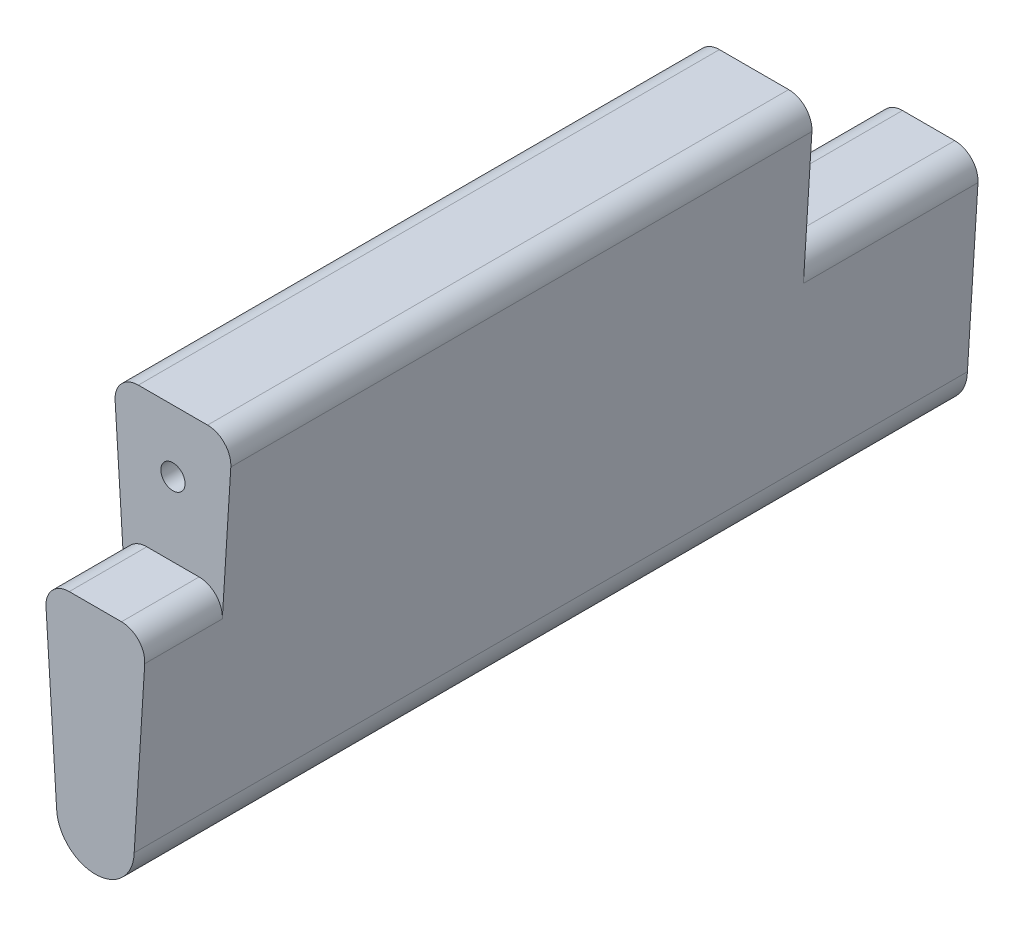
from build123d import *

# Parameters (mm, degrees)
BOSS_EXTRUDE1_DEPTH             = 76.2
BOSS_EXTRUDE1_DEPTH_BACK        = 76.2
CUT_EXTRUDE1_DEPTH              = 136.619651209
CUT_EXTRUDE1_DEPTH_BACK         = 136.619651209
FILLET1_R                       = 3.81
SHELL1_START                    = -44.45
SHELL1_DEPTH                    = 88.773
SHELL1_START_2                  = -73.025
SHELL1_2_DEPTH                  = 130.048
SKETCH14_R                      = 1.984375
CUT_EXTRUDE8_DEPTH              = 156.372005628
BOSS_EXTRUDE4_REACH             = 137.201
SKETCH15_R                      = 1.5875
BOSS_EXTRUDE4_DIRECTION_2_REACH = 137.201


# Read off the part's stored shape, not the designer's step: Shell1
with BuildPart() as part:
    # Sketch1 → Boss-Extrude1 (new, two sides: drawn at the far end of the back side and taken through both)
    with BuildSketch(Plane.XY.offset(-BOSS_EXTRUDE1_DEPTH_BACK)):
        with BuildLine():
            Line((-6.335258536, -105.245804705), (-12.685258536, -3.645804705))
            ThreePointArc((-12.685258536, -3.645804705), (0.014741464, 8.866413132), (12.714741464, -3.645804705))
            Line((12.714741464, -3.645804705), (6.364741464, -105.245804705))
            ThreePointArc((6.364741464, -105.245804705), (0.014741464, -111.465623147), (-6.335258536, -105.245804705))
        make_face()
    extrude(amount=BOSS_EXTRUDE1_DEPTH + BOSS_EXTRUDE1_DEPTH_BACK)

    # Sketch4 → Cut-Extrude1 (cut, two sides: drawn at the far end of the back side and taken through both)
    with BuildSketch(Plane(origin=(0, 0, 0), x_dir=(0, 0, -1), z_dir=(1, 0, 0)).offset(-CUT_EXTRUDE1_DEPTH_BACK)):
        Polygon((-47.498, -73.524605007), (-47.498, -51.299605007), (47.625, -51.299605007), (47.625, -73.524605007), (76.2, -73.524605007), (76.2, 8.866413132), (-76.2, 8.866413132), (-76.2, -28.682279346), (-76.2, -111.465623147), (-60.198, -111.465623147), (-60.198, -73.524605007), align=None)
    extrude(amount=CUT_EXTRUDE1_DEPTH + CUT_EXTRUDE1_DEPTH_BACK, mode=Mode.SUBTRACT)

    # Fillet1
    fillet1_edges = [part.edges().sort_by_distance(p)[0] for p in [
        (8.347316445, -73.524605007, 53.848),
        (9.736378945, -51.299605007, -0.0635),
        (-9.706896017, -51.299605007, -0.0635),
        (-8.317833517, -73.524605007, 53.848),
        (-8.317833517, -73.524605007, -61.9125),
        (8.347316445, -73.524605007, -61.9125),
    ]]
    fillet(fillet1_edges, radius=FILLET1_R)

    # Shell1 outline → Shell1 (cut)
    with BuildSketch(Plane.XY.offset(SHELL1_START)):
        with BuildLine():
            ThreePointArc((-3.161602106, -105.125185529), (0.014741465, -108.290623147), (3.191085035, -105.125185529))
            Line((3.191085035, -105.125185529), (6.314583179, -55.149215219))
            ThreePointArc((6.314583179, -55.149215219), (6.143625088, -54.674822007), (5.680819792, -54.474605007))
            Line((5.680819792, -54.474605007), (-5.651336863, -54.474605007))
            ThreePointArc((-5.651336863, -54.474605007), (-6.114142159, -54.674822006), (-6.285100251, -55.149215219))
            Line((-6.285100251, -55.149215219), (-3.161602106, -105.125185529))
        make_face()
    extrude(amount=SHELL1_DEPTH, mode=Mode.SUBTRACT)

    # Shell1 2 outline → Shell1 2 (cut)
    with BuildSketch(Plane.XY.offset(SHELL1_START_2)):
        with BuildLine():
            Line((-4.896037751, -77.374215219), (-3.161602106, -105.125185529))
            ThreePointArc((-3.161602106, -105.125185529), (0.014741465, -108.290623147), (3.191085035, -105.125185529))
            Line((3.191085035, -105.125185529), (4.925520679, -77.374215219))
            ThreePointArc((4.925520679, -77.374215219), (4.754562588, -76.899822007), (4.291757292, -76.699605007))
            Line((4.291757292, -76.699605007), (-4.262274363, -76.699605007))
            ThreePointArc((-4.262274363, -76.699605007), (-4.725079659, -76.899822006), (-4.896037751, -77.374215219))
        make_face()
    extrude(amount=SHELL1_2_DEPTH, mode=Mode.SUBTRACT)

    # Sketch14 → Cut-Extrude8 (cut, through all)
    with BuildSketch(Plane(origin=(0, 0, -47.625), x_dir=(-1, 0, 0), z_dir=(0, 0, -1))):
        with Locations((-0.014741464, -61.459605007)):
            Circle(SKETCH14_R)
    extrude(amount=-CUT_EXTRUDE8_DEPTH, mode=Mode.SUBTRACT)

    # Boss-Extrude4: up to this plane
    boss_extrude4_end = Plane(origin=(3.195924528, -105.047753647, -76.2), z_dir=(0.9980525784828886, -0.062378286155180485, 0))
    # Sketch15 → Boss-Extrude4 (add, up to the surface)
    with BuildSketch(Plane(origin=(3.191103822, -0.502900096, 0), x_dir=(0, 0, -1), z_dir=(1, 0, 0)), mode=Mode.PRIVATE) as boss_extrude4_sk1:
        with Locations(Location((-9.398, -66.274366182, 0), (0, 0, 270))):
            Circle(SKETCH15_R)
    boss_extrude4_tool1 = split(extrude(boss_extrude4_sk1.sketch, amount=BOSS_EXTRUDE4_REACH, mode=Mode.PRIVATE), bisect_by=boss_extrude4_end, keep=Keep.BOTH, mode=Mode.PRIVATE)
    add(boss_extrude4_tool1.solids().sort_by_distance((3.191104, -66.777266, 9.398))[0])
    # Sketch15 → Boss-Extrude4 (add, up to the surface)
    with BuildSketch(Plane(origin=(3.191103822, -0.502900096, 0), x_dir=(0, 0, -1), z_dir=(1, 0, 0)), mode=Mode.PRIVATE) as boss_extrude4_sk2:
        with Locations(Location((26.868345804, -77.595887652, 0), (0, 0, 270))):
            Circle(SKETCH15_R)
    boss_extrude4_tool2 = split(extrude(boss_extrude4_sk2.sketch, amount=BOSS_EXTRUDE4_REACH, mode=Mode.PRIVATE), bisect_by=boss_extrude4_end, keep=Keep.BOTH, mode=Mode.PRIVATE)
    add(boss_extrude4_tool2.solids().sort_by_distance((3.191104, -78.098788, -26.868346))[0])
    # Sketch15 → Boss-Extrude4 (add, up to the surface)
    with BuildSketch(Plane(origin=(3.191103822, -0.502900096, 0), x_dir=(0, 0, -1), z_dir=(1, 0, 0)), mode=Mode.PRIVATE) as boss_extrude4_sk3:
        with Locations(Location((-22.098, -96.55076585, 0), (0, 0, 270))):
            Circle(SKETCH15_R)
    boss_extrude4_tool3 = split(extrude(boss_extrude4_sk3.sketch, amount=BOSS_EXTRUDE4_REACH, mode=Mode.PRIVATE), bisect_by=boss_extrude4_end, keep=Keep.BOTH, mode=Mode.PRIVATE)
    add(boss_extrude4_tool3.solids().sort_by_distance((3.191104, -97.053666, 22.098))[0])
    # Sketch15 → Boss-Extrude4 (add, up to the surface)
    with BuildSketch(Plane(origin=(3.191103822, -0.502900096, 0), x_dir=(0, 0, -1), z_dir=(1, 0, 0)), mode=Mode.PRIVATE) as boss_extrude4_sk4:
        with Locations(Location((16.002, -96.55076585, 0), (0, 0, 270))):
            Circle(SKETCH15_R)
    boss_extrude4_tool4 = split(extrude(boss_extrude4_sk4.sketch, amount=BOSS_EXTRUDE4_REACH, mode=Mode.PRIVATE), bisect_by=boss_extrude4_end, keep=Keep.BOTH, mode=Mode.PRIVATE)
    add(boss_extrude4_tool4.solids().sort_by_distance((3.191104, -97.053666, -16.002))[0])
    # Sketch15 → Boss-Extrude4 (add, up to the surface)
    with BuildSketch(Plane(origin=(3.191103822, -0.502900096, 0), x_dir=(0, 0, -1), z_dir=(1, 0, 0)), mode=Mode.PRIVATE) as boss_extrude4_sk5:
        with Locations(Location((54.102, -96.55076585, 0), (0, 0, 270))):
            Circle(SKETCH15_R)
    boss_extrude4_tool5 = split(extrude(boss_extrude4_sk5.sketch, amount=BOSS_EXTRUDE4_REACH, mode=Mode.PRIVATE), bisect_by=boss_extrude4_end, keep=Keep.BOTH, mode=Mode.PRIVATE)
    add(boss_extrude4_tool5.solids().sort_by_distance((3.191104, -97.053666, -54.102))[0])

    # Boss-Extrude4 direction 2: up to this plane
    boss_extrude4_direction_2_end = Plane(origin=(-3.166441599, -105.047753647, -76.2), z_dir=(-0.9980525784828886, -0.0623782861551806, 0))
    # Sketch15 → Boss-Extrude4 direction 2 (add, up to the surface)
    with BuildSketch(Plane(origin=(3.191103822, -0.502900096, 0), x_dir=(0, 0, -1), z_dir=(1, 0, 0)), mode=Mode.PRIVATE) as boss_extrude4_direction_2_sk1:
        with Locations(Location((-9.398, -66.274366182, 0), (0, 0, 270))):
            Circle(SKETCH15_R)
    boss_extrude4_direction_2_tool1 = split(extrude(boss_extrude4_direction_2_sk1.sketch, amount=-BOSS_EXTRUDE4_DIRECTION_2_REACH, mode=Mode.PRIVATE), bisect_by=boss_extrude4_direction_2_end, keep=Keep.BOTH, mode=Mode.PRIVATE)
    add(boss_extrude4_direction_2_tool1.solids().sort_by_distance((3.191104, -66.777266, 9.398))[0])
    # Sketch15 → Boss-Extrude4 direction 2 (add, up to the surface)
    with BuildSketch(Plane(origin=(3.191103822, -0.502900096, 0), x_dir=(0, 0, -1), z_dir=(1, 0, 0)), mode=Mode.PRIVATE) as boss_extrude4_direction_2_sk2:
        with Locations(Location((26.868345804, -77.595887652, 0), (0, 0, 270))):
            Circle(SKETCH15_R)
    boss_extrude4_direction_2_tool2 = split(extrude(boss_extrude4_direction_2_sk2.sketch, amount=-BOSS_EXTRUDE4_DIRECTION_2_REACH, mode=Mode.PRIVATE), bisect_by=boss_extrude4_direction_2_end, keep=Keep.BOTH, mode=Mode.PRIVATE)
    add(boss_extrude4_direction_2_tool2.solids().sort_by_distance((3.191104, -78.098788, -26.868346))[0])
    # Sketch15 → Boss-Extrude4 direction 2 (add, up to the surface)
    with BuildSketch(Plane(origin=(3.191103822, -0.502900096, 0), x_dir=(0, 0, -1), z_dir=(1, 0, 0)), mode=Mode.PRIVATE) as boss_extrude4_direction_2_sk3:
        with Locations(Location((-22.098, -96.55076585, 0), (0, 0, 270))):
            Circle(SKETCH15_R)
    boss_extrude4_direction_2_tool3 = split(extrude(boss_extrude4_direction_2_sk3.sketch, amount=-BOSS_EXTRUDE4_DIRECTION_2_REACH, mode=Mode.PRIVATE), bisect_by=boss_extrude4_direction_2_end, keep=Keep.BOTH, mode=Mode.PRIVATE)
    add(boss_extrude4_direction_2_tool3.solids().sort_by_distance((3.191104, -97.053666, 22.098))[0])
    # Sketch15 → Boss-Extrude4 direction 2 (add, up to the surface)
    with BuildSketch(Plane(origin=(3.191103822, -0.502900096, 0), x_dir=(0, 0, -1), z_dir=(1, 0, 0)), mode=Mode.PRIVATE) as boss_extrude4_direction_2_sk4:
        with Locations(Location((16.002, -96.55076585, 0), (0, 0, 270))):
            Circle(SKETCH15_R)
    boss_extrude4_direction_2_tool4 = split(extrude(boss_extrude4_direction_2_sk4.sketch, amount=-BOSS_EXTRUDE4_DIRECTION_2_REACH, mode=Mode.PRIVATE), bisect_by=boss_extrude4_direction_2_end, keep=Keep.BOTH, mode=Mode.PRIVATE)
    add(boss_extrude4_direction_2_tool4.solids().sort_by_distance((3.191104, -97.053666, -16.002))[0])
    # Sketch15 → Boss-Extrude4 direction 2 (add, up to the surface)
    with BuildSketch(Plane(origin=(3.191103822, -0.502900096, 0), x_dir=(0, 0, -1), z_dir=(1, 0, 0)), mode=Mode.PRIVATE) as boss_extrude4_direction_2_sk5:
        with Locations(Location((54.102, -96.55076585, 0), (0, 0, 270))):
            Circle(SKETCH15_R)
    boss_extrude4_direction_2_tool5 = split(extrude(boss_extrude4_direction_2_sk5.sketch, amount=-BOSS_EXTRUDE4_DIRECTION_2_REACH, mode=Mode.PRIVATE), bisect_by=boss_extrude4_direction_2_end, keep=Keep.BOTH, mode=Mode.PRIVATE)
    add(boss_extrude4_direction_2_tool5.solids().sort_by_distance((3.191104, -97.053666, -54.102))[0])


solid = part.part
